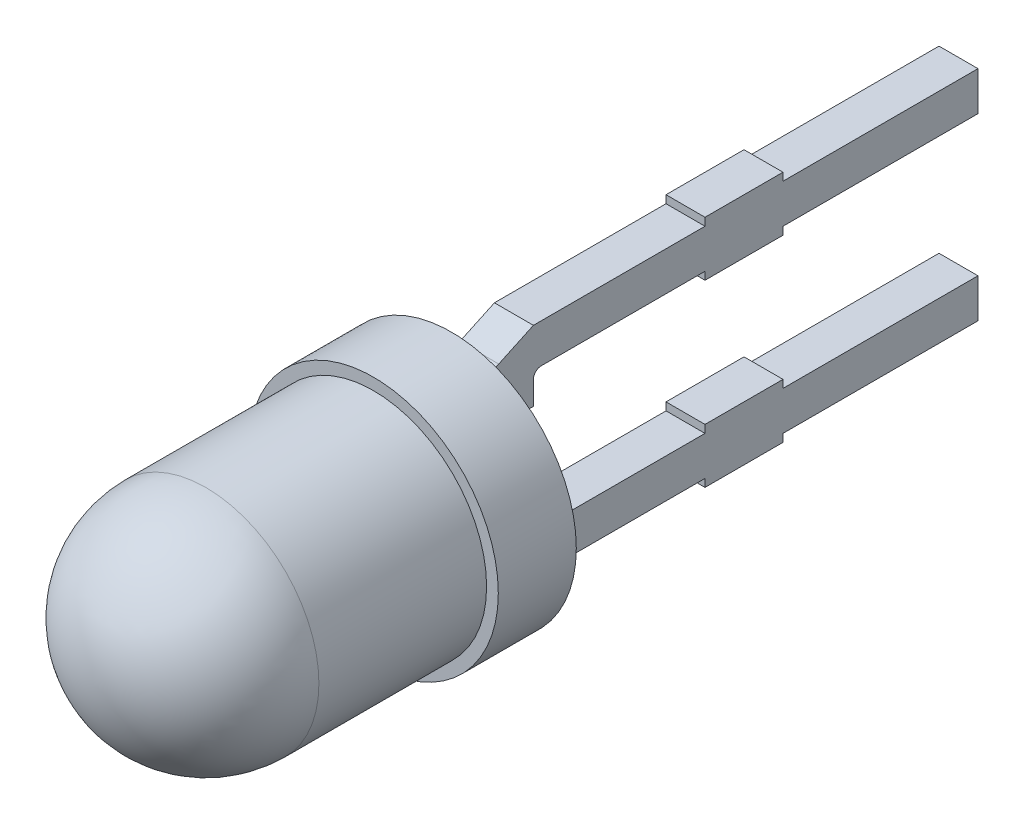
from build123d import *

# Parameters (mm, degrees)
EXTRUDE1_DEPTH          = 0.25
FILLET1_R               = 0.25
CUT_EXTRUDE1_DEPTH      = 31.234789562
CUT_EXTRUDE1_DEPTH_BACK = 31.234789562
SKETCH3_W               = 12
SKETCH3_H               = 2.8
CUT_EXTRUDE2_DEPTH      = 19.290502996
CUT_EXTRUDE2_DEPTH_BACK = 19.290502996
SKETCH4_W               = 11.848128118
SKETCH4_H               = 6.339341797


with BuildPart() as part:
    # Sketch1 → Revolve1 (revolve)
    with BuildSketch(Plane(origin=(0, 0, 0), x_dir=(0, 0, -1), z_dir=(1, 0, 0))):
        with BuildLine():
            Line((0, 1.45), (2.15, 1.45))
            Line((2.15, 1.45), (2.15, 1.599999975))
            Line((2.15, 1.599999975), (3.15, 1.599999975))
            Line((3.15, 1.599999975), (3.15, 0))
            Line((3.15, 0), (-1.45, 0))
            ThreePointArc((-1.45, 0), (-1.025304833, 1.025304833), (0, 1.45))
        make_face()
    revolve(axis=Axis((0, 0, 0), (0, 0, -1)))

    # Sketch2 → Extrude1 (add, symmetric)
    with BuildSketch(Plane(origin=(0, 0, 0), x_dir=(0, 0, -1), z_dir=(1, 0, 0))):
        with BuildLine():
            Line((3.15, 1.026953873), (3.95, 1.4))
            Line((3.95, 1.4), (6.15, 1.4))
            Line((6.15, 1.4), (6.15, 1.5))
            Line((6.15, 1.5), (7.15, 1.5))
            Line((7.15, 1.5), (7.15, 1.4))
            Line((7.15, 1.4), (30.15, 1.4))
            Line((30.15, 1.4), (30.15, 0.9))
            Line((30.15, 0.9), (7.15, 0.9))
            Line((7.15, 0.9), (7.15, 0.8))
            Line((7.15, 0.8), (6.15, 0.8))
            Line((6.15, 0.8), (6.15, 0.9))
            Line((6.15, 0.9), (4.05, 0.9))
            ThreePointArc((4.05, 0.9), (3.979289322, 0.870710678), (3.95, 0.8))
            Line((3.95, 0.8), (3.95, 0.5))
            Line((3.95, 0.5), (3.15, 0.5))
            Line((3.15, 0.5), (3.15, 1.026953873))
        make_face()
        with BuildLine():
            Line((3.95, -0.8), (3.95, -0.5))
            Line((3.95, -0.5), (3.15, -0.5))
            Line((3.15, -0.5), (3.15, -1.026953873))
            Line((3.15, -1.026953873), (3.95, -1.4))
            Line((3.95, -1.4), (6.15, -1.4))
            Line((6.15, -1.4), (6.15, -1.5))
            Line((6.15, -1.5), (7.15, -1.5))
            Line((7.15, -1.5), (7.15, -1.4))
            Line((7.15, -1.4), (30.15, -1.4))
            Line((30.15, -1.4), (30.15, -0.9))
            Line((30.15, -0.9), (7.15, -0.9))
            Line((7.15, -0.9), (7.15, -0.8))
            Line((7.15, -0.8), (6.15, -0.8))
            Line((6.15, -0.8), (6.15, -0.9))
            Line((6.15, -0.9), (4.05, -0.9))
            ThreePointArc((4.05, -0.9), (3.979289322, -0.870710678), (3.95, -0.8))
        make_face()
    extrude(amount=EXTRUDE1_DEPTH, both=True)

    # Fillet1
    fillet1_edges = [part.edges().sort_by_distance(p)[0] for p in [
        (0, -0.5, -3.15),
        (0, -1.026953873, -3.15),
        (-0.25, -0.763476937, -3.15),
        (0, 0.5, -3.15),
        (-0.25, 0.763476937, -3.15),
        (0, 1.026953873, -3.15),
        (0.25, 0.763476937, -3.15),
        (0.25, -0.763476937, -3.15),
    ]]
    fillet(fillet1_edges, radius=FILLET1_R)

    # Sketch3 → Cut-Extrude1 (cut, two sides: drawn at the far end of the back side and taken through both)
    with BuildSketch(Plane(origin=(0, 0, 0), x_dir=(0, 0, -1), z_dir=(1, 0, 0)).offset(-CUT_EXTRUDE1_DEPTH_BACK)):
        with Locations((24.15, 0)):
            Rectangle(SKETCH3_W, SKETCH3_H)
    extrude(amount=CUT_EXTRUDE1_DEPTH + CUT_EXTRUDE1_DEPTH_BACK, mode=Mode.SUBTRACT)

    # Sketch4 → Cut-Extrude2 (cut, two sides: drawn at the far end of the back side and taken through both)
    with BuildSketch(Plane(origin=(0, 0, 0), x_dir=(0, 0, -1), z_dir=(1, 0, 0)).offset(-CUT_EXTRUDE2_DEPTH_BACK)):
        with Locations((15.574064059, -0.110175727)):
            Rectangle(SKETCH4_W, SKETCH4_H)
    extrude(amount=CUT_EXTRUDE2_DEPTH + CUT_EXTRUDE2_DEPTH_BACK, mode=Mode.SUBTRACT)


solid = part.part
